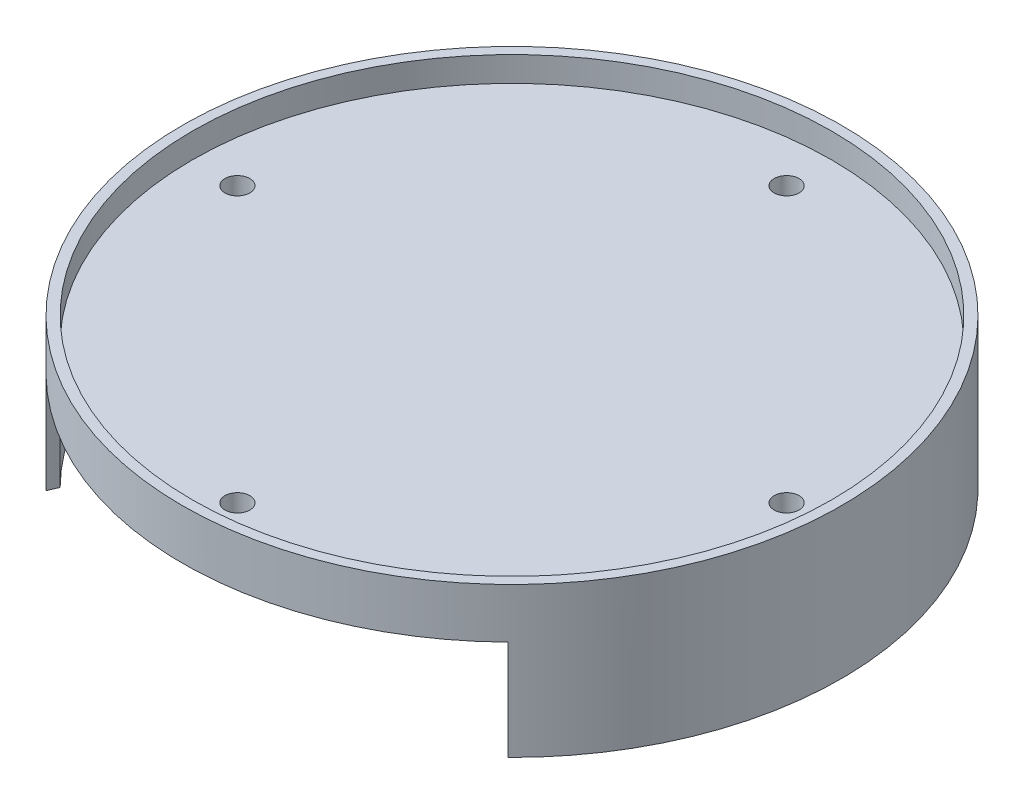
from build123d import *

# Parameters (mm, degrees)
SKETCH1_R               = 33
SKETCH1_R_2             = 1.25
BOSS_EXTRUDE1_DEPTH     = 12.5
SKETCH2_R               = 32
CUT_EXTRUDE2_DEPTH      = 10
SKETCH8_R               = 33
SKETCH8_R_2             = 32
BOSS_EXTRUDE2_DEPTH     = 15
CUT_REVOLVE_THIN2_DEPTH = 10


# Read off the part's stored shape, not the designer's step: Cut-Revolve-Thin2
with BuildPart() as part:
    # Sketch1 → Boss-Extrude1 (new body)
    with BuildSketch(Plane(origin=(0, 0, 0), x_dir=(1, 0, 0), z_dir=(0, 1, 0))):
        with Locations(Location((0, 0, 0), (0, 0, 270))):
            Circle(SKETCH1_R)
        with Locations(Location((0, 27.5, 0), (0, 0, 270))):
            Circle(SKETCH1_R_2, mode=Mode.SUBTRACT)
        with Locations(Location((27.5, 0, 0), (0, 0, 270))):
            Circle(SKETCH1_R_2, mode=Mode.SUBTRACT)
        with Locations(Location((0, -27.5, 0), (0, 0, 270))):
            Circle(SKETCH1_R_2, mode=Mode.SUBTRACT)
        with Locations(Location((-27.5, 0, 0), (0, 0, 270))):
            Circle(SKETCH1_R_2, mode=Mode.SUBTRACT)
    extrude(amount=BOSS_EXTRUDE1_DEPTH)

    # Sketch2 → Cut-Extrude2 (cut)
    with BuildSketch(Plane(origin=(0, 0, 0), x_dir=(1, 0, 0), z_dir=(0, 1, 0))):
        with Locations(Location((0, 0, 0), (0, 0, 270))):
            Circle(SKETCH2_R)
    extrude(amount=CUT_EXTRUDE2_DEPTH, mode=Mode.SUBTRACT)

    # Sketch8 → Boss-Extrude2 (add)
    with BuildSketch(Plane(origin=(0, 0, 0), x_dir=(1, 0, 0), z_dir=(0, 1, 0))):
        with Locations(Location((0, 0, 0), (0, 0, 270))):
            Circle(SKETCH8_R)
        with Locations(Location((0, 0, 0), (0, 0, 270))):
            Circle(SKETCH8_R_2, mode=Mode.SUBTRACT)
    extrude(amount=BOSS_EXTRUDE2_DEPTH)

    # Cut-Revolve-Thin2 outline → Cut-Revolve-Thin2 (cut)
    with BuildSketch(Plane(origin=(0, 0, 0), x_dir=(1, 0, 0), z_dir=(0, 1, 0))):
        with BuildLine():
            ThreePointArc((-22.709083631, -22.545454545), (-22.928374212, -23.0355805), (-23.137087961, -23.53030303))
            ThreePointArc((-23.137087961, -23.53030303), (0, -33), (23.137087961, -23.53030303))
            ThreePointArc((23.137087961, -23.53030303), (22.928374212, -23.0355805), (22.709083631, -22.545454545))
            ThreePointArc((22.709083631, -22.545454545), (0, -32), (-22.709083631, -22.545454545))
        make_face()
    extrude(amount=CUT_REVOLVE_THIN2_DEPTH, mode=Mode.SUBTRACT)


solid = part.part
